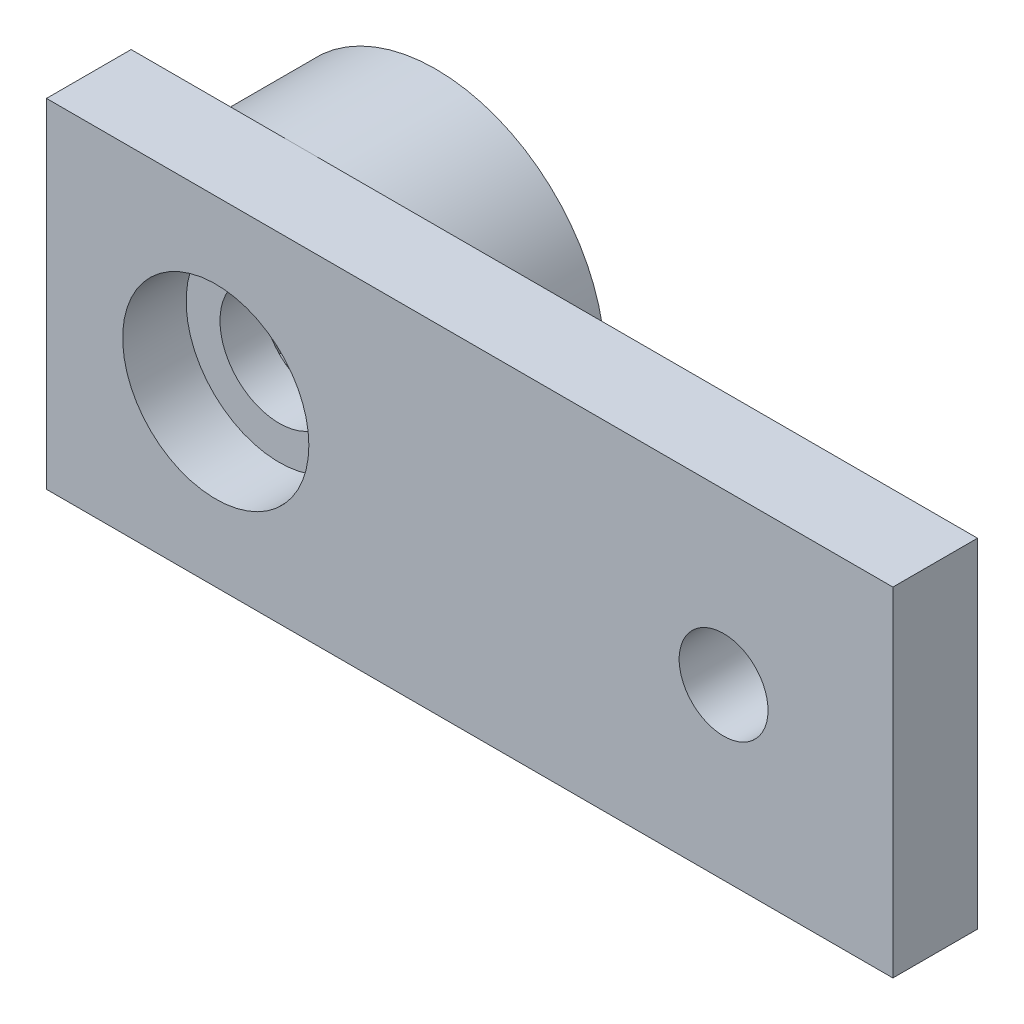
from build123d import *

# Parameters (mm, degrees)
SKETCH1_W                                    = 20
SKETCH1_H                                    = 8
SKETCH1_R                                    = 2.6
SKETCH1_R_2                                  = 1.05
R12_HORN_ENVELOPE_DEPTH                      = 2
REPLACE_CLEARANCE_BORE_WITH_DRIVE_WEB_START  = -0.5
SKETCH2_R                                    = 2.61
REPLACE_CLEARANCE_BORE_WITH_DRIVE_WEB_DEPTH  = 2.5
CUSTOM_SPLINE_HUB_START                      = -3.2
SKETCH3_R                                    = 4
CUSTOM_SPLINE_HUB_DEPTH                      = 3.5
SKETCH4_R                                    = 1.1
M2_RETAINING_SCREW_CLEARANCE_DEPTH           = 5.21
SKETCH5_R                                    = 2.2
SCREW_HEAD_POCKET_D4P4_DEPTH                 = 1.5
FEMALE_SPLINE_FROM_OFFICIAL_21T_STEP_START   = -3.126
FEMALE_SPLINE_FROM_OFFICIAL_21T_STEP_2_O_R   = 2.121
FEMALE_SPLINE_FROM_OFFICIAL_21T_STEP_2_DEPTH = 2.619649147
SKETCH6_R                                    = 2.6
SPLINE_BASE_ENTRY_RELIEF_D5P2_DEPTH          = 0.5
SKETCH7_R                                    = 1.4
SPLINE_CENTRE_TIP_RELIEF_D2P8_DEPTH          = 1.25


with BuildPart() as part:
    # Sketch1 → R12_Horn_Envelope (new body)
    with BuildSketch(Plane.XY):
        with Locations((6, 0)):
            Rectangle(SKETCH1_W, SKETCH1_H)
        Circle(SKETCH1_R, mode=Mode.SUBTRACT)
        with Locations((12, 0)):
            Circle(SKETCH1_R_2, mode=Mode.SUBTRACT)
    extrude(amount=R12_HORN_ENVELOPE_DEPTH)

    # Sketch2 → Replace_Clearance_Bore_With_Drive_Web (add)
    with BuildSketch(Plane.XY.offset(REPLACE_CLEARANCE_BORE_WITH_DRIVE_WEB_START)):
        with Locations(Location((0, 0, 0), (0, 0, 180))):
            Circle(SKETCH2_R)
    extrude(amount=REPLACE_CLEARANCE_BORE_WITH_DRIVE_WEB_DEPTH)

    # Sketch3 → Custom_Spline_Hub (add)
    with BuildSketch(Plane.XY.offset(CUSTOM_SPLINE_HUB_START)):
        with Locations(Location((0, 0, 0), (0, 0, 180))):
            Circle(SKETCH3_R)
    extrude(amount=CUSTOM_SPLINE_HUB_DEPTH)

    # Sketch4 → M2_Retaining_Screw_Clearance (cut)
    with BuildSketch(Plane.XY.offset(2)):
        Circle(SKETCH4_R)
    extrude(amount=-M2_RETAINING_SCREW_CLEARANCE_DEPTH, mode=Mode.SUBTRACT)

    # Sketch5 → Screw_Head_Pocket_D4p4 (cut)
    with BuildSketch(Plane.XY.offset(2)):
        Circle(SKETCH5_R)
    extrude(amount=-SCREW_HEAD_POCKET_D4P4_DEPTH, mode=Mode.SUBTRACT)

    # Female_Spline_From_Official_21T_STEP: read off the stored shape, not the designer's step
    # Female_Spline_From_Official_21T_STEP out → Female_Spline_From_Official_21T_STEP (revolve, cut)
    with BuildSketch(Plane.XZ):
        Polygon((1.111, -0.5), (1.1, -0.506350853), (1.1, -3.2), (2.121, -3.2), (2.121, -0.506350853), (2.127350853, -0.506350853), (2.121, -0.5), align=None)
    revolve(axis=Axis((0, 0, 0), (0, 0, 1)), mode=Mode.SUBTRACT)

    # Female_Spline_From_Official_21T_STEP 2 o → Female_Spline_From_Official_21T_STEP 2 (cut)
    with BuildSketch(Plane.XY.offset(FEMALE_SPLINE_FROM_OFFICIAL_21T_STEP_START)):
        with BuildLine():
            ThreePointArc((-2.507829748, 0.29396421), (-2.517939588, 0.188693486), (-2.523632453, 0.083091756))
            Line((-2.523632453, 0.083091756), (-2.192108096, -0.07656196))
            ThreePointArc((-2.192108096, -0.07656196), (-2.135212771, -0.160012076), (-2.179035028, -0.251009932))
            Line((-2.179035028, -0.251009932), (-2.48306138, -0.458291589))
            ThreePointArc((-2.48306138, -0.458291589), (-2.461692978, -0.561865358), (-2.436006269, -0.664453502))
            Line((-2.436006269, -0.664453502), (-2.07215185, -0.719295731))
            ThreePointArc((-2.07215185, -0.719295731), (-1.993186871, -0.782268202), (-2.008240139, -0.882140115))
            Line((-2.008240139, -0.882140115), (-2.237662113, -1.16982617))
            ThreePointArc((-2.237662113, -1.16982617), (-2.186714145, -1.2625), (-2.131930238, -1.35295915))
            Line((-2.131930238, -1.35295915), (-1.768075819, -1.29811692))
            ThreePointArc((-1.768075819, -1.29811692), (-1.67405757, -1.335016364), (-1.659004301, -1.434888277))
            Line((-1.659004301, -1.434888277), (-1.793436747, -1.777416562))
            ThreePointArc((-1.793436747, -1.777416562), (-1.717436163, -1.850955976), (-1.638422849, -1.92124844))
            Line((-1.638422849, -1.92124844), (-1.306898492, -1.761594724))
            ThreePointArc((-1.306898492, -1.761594724), (-1.206180909, -1.769142464), (-1.162358651, -1.860140319))
            Line((-1.162358651, -1.860140319), (-1.189856655, -2.227075692))
            ThreePointArc((-1.189856655, -2.227075692), (-1.095556441, -2.274946391), (-0.9993344, -2.318826375))
            Line((-0.9993344, -2.318826375), (-0.729597499, -2.068547106))
            ThreePointArc((-0.729597499, -2.068547106), (-0.63112978, -2.046072492), (-0.562432333, -2.120110731))
            Line((-0.562432333, -2.120110731), (-0.480552579, -2.478849374))
            ThreePointArc((-0.480552579, -2.478849374), (-0.376331722, -2.496797836), (-0.271450704, -2.510366411))
            Line((-0.271450704, -2.510366411), (-0.087468566, -2.1917))
            ThreePointArc((-0.087468566, -2.1917), (0, -2.1412), (0.087468566, -2.1917))
            Line((0.087468566, -2.1917), (0.271450704, -2.510366411))
            ThreePointArc((0.271450704, -2.510366411), (0.376331722, -2.496797836), (0.480552579, -2.478849374))
            Line((0.480552579, -2.478849374), (0.562432333, -2.120110731))
            ThreePointArc((0.562432333, -2.120110731), (0.63112978, -2.046072492), (0.729597499, -2.068547106))
            Line((0.729597499, -2.068547106), (0.9993344, -2.318826375))
            ThreePointArc((0.9993344, -2.318826375), (1.095556441, -2.274946391), (1.189856655, -2.227075692))
            Line((1.189856655, -2.227075692), (1.162358651, -1.860140319))
            ThreePointArc((1.162358651, -1.860140319), (1.206180909, -1.769142464), (1.306898492, -1.761594724))
            Line((1.306898492, -1.761594724), (1.638422849, -1.92124844))
            ThreePointArc((1.638422849, -1.92124844), (1.717436163, -1.850955976), (1.793436747, -1.777416562))
            Line((1.793436747, -1.777416562), (1.659004301, -1.434888277))
            ThreePointArc((1.659004301, -1.434888277), (1.67405757, -1.335016364), (1.768075819, -1.29811692))
            Line((1.768075819, -1.29811692), (2.131930238, -1.35295915))
            ThreePointArc((2.131930238, -1.35295915), (2.186714145, -1.2625), (2.237662113, -1.16982617))
            Line((2.237662113, -1.16982617), (2.008240139, -0.882140115))
            ThreePointArc((2.008240139, -0.882140115), (1.993186871, -0.782268202), (2.07215185, -0.719295731))
            Line((2.07215185, -0.719295731), (2.436006269, -0.664453502))
            ThreePointArc((2.436006269, -0.664453502), (2.461692978, -0.561865358), (2.48306138, -0.458291589))
            Line((2.48306138, -0.458291589), (2.179035028, -0.251009932))
            ThreePointArc((2.179035028, -0.251009932), (2.135212771, -0.160012076), (2.192108096, -0.07656196))
            Line((2.192108096, -0.07656196), (2.523632453, 0.083091756))
            ThreePointArc((2.523632453, 0.083091756), (2.517939588, 0.188693486), (2.507829748, 0.29396421))
            Line((2.507829748, 0.29396421), (2.156213092, 0.402423585))
            ThreePointArc((2.156213092, 0.402423585), (2.087515646, 0.476461824), (2.117285918, 0.572974677))
            Line((2.117285918, 0.572974677), (2.387022819, 0.823253946))
            ThreePointArc((2.387022819, 0.823253946), (2.350456215, 0.922486087), (2.309766436, 1.0201))
            Line((2.309766436, 1.0201), (1.94180216, 1.0201))
            ThreePointArc((1.94180216, 1.0201), (1.854333595, 1.0706), (1.854333595, 1.1716))
            Line((1.854333595, 1.1716), (2.038315733, 1.490266411))
            ThreePointArc((2.038315733, 1.490266411), (1.974124493, 1.57431175), (1.906470241, 1.655595428))
            Line((1.906470241, 1.655595428), (1.554853585, 1.547136054))
            ThreePointArc((1.554853585, 1.547136054), (1.456385866, 1.569610668), (1.426615593, 1.666123521))
            Line((1.426615593, 1.666123521), (1.508495348, 2.024862165))
            ThreePointArc((1.508495348, 2.024862165), (1.422383147, 2.086252905), (1.333775798, 2.143983937))
            Line((1.333775798, 2.143983937), (1.029749446, 1.936702279))
            ThreePointArc((1.029749446, 1.936702279), (0.929031862, 1.92915454), (0.872136536, 2.012604656))
            Line((0.872136536, 2.012604656), (0.844638532, 2.379540029))
            ThreePointArc((0.844638532, 2.379540029), (0.744256816, 2.412821335), (0.642569522, 2.441870064))
            Line((0.642569522, 2.441870064), (0.413147549, 2.154184009))
            ThreePointArc((0.413147549, 2.154184009), (0.319129301, 2.117284565), (0.240164321, 2.180257035))
            Line((0.240164321, 2.180257035), (0.105731875, 2.52278532))
            ThreePointArc((0.105731875, 2.52278532), (0, 2.525), (-0.105731875, 2.52278532))
            Line((-0.105731875, 2.52278532), (-0.240164321, 2.180257035))
            ThreePointArc((-0.240164321, 2.180257035), (-0.319129301, 2.117284565), (-0.413147549, 2.154184009))
            Line((-0.413147549, 2.154184009), (-0.642569522, 2.441870064))
            ThreePointArc((-0.642569522, 2.441870064), (-0.744256816, 2.412821335), (-0.844638532, 2.379540029))
            Line((-0.844638532, 2.379540029), (-0.872136536, 2.012604656))
            ThreePointArc((-0.872136536, 2.012604656), (-0.929031862, 1.92915454), (-1.029749446, 1.936702279))
            Line((-1.029749446, 1.936702279), (-1.333775798, 2.143983937))
            ThreePointArc((-1.333775798, 2.143983937), (-1.422383147, 2.086252905), (-1.508495348, 2.024862165))
            Line((-1.508495348, 2.024862165), (-1.426615593, 1.666123521))
            ThreePointArc((-1.426615593, 1.666123521), (-1.456385866, 1.569610668), (-1.554853585, 1.547136054))
            Line((-1.554853585, 1.547136054), (-1.906470241, 1.655595428))
            ThreePointArc((-1.906470241, 1.655595428), (-1.974124493, 1.57431175), (-2.038315733, 1.490266411))
            Line((-2.038315733, 1.490266411), (-1.854333595, 1.1716))
            ThreePointArc((-1.854333595, 1.1716), (-1.854333595, 1.0706), (-1.94180216, 1.0201))
            Line((-1.94180216, 1.0201), (-2.309766436, 1.0201))
            ThreePointArc((-2.309766436, 1.0201), (-2.350456215, 0.922486087), (-2.387022819, 0.823253946))
            Line((-2.387022819, 0.823253946), (-2.117285918, 0.572974677))
            ThreePointArc((-2.117285918, 0.572974677), (-2.087515646, 0.476461824), (-2.156213092, 0.402423585))
            Line((-2.156213092, 0.402423585), (-2.507829748, 0.29396421))
        make_face()
        Circle(FEMALE_SPLINE_FROM_OFFICIAL_21T_STEP_2_O_R, mode=Mode.SUBTRACT)
    extrude(amount=FEMALE_SPLINE_FROM_OFFICIAL_21T_STEP_2_DEPTH, mode=Mode.SUBTRACT)

    # Female_Spline_From_Official_21T_STEP 3 o → Female_Spline_From_Official_21T_STEP 3 (revolve)
    with BuildSketch(Plane.XZ):
        Polygon((2.525000001, -0.506350853), (2.127350853, -0.506350853), (2.525, -0.904), align=None)
    revolve(axis=Axis((0, 0, 0), (0, 0, 1)))

    # Sketch6 → Spline_Base_Entry_Relief_D5p2 (cut)
    with BuildSketch(Plane(origin=(0, 0, -3.2), x_dir=(-1, 0, 0), z_dir=(0, 0, -1))):
        Circle(SKETCH6_R)
    extrude(amount=-SPLINE_BASE_ENTRY_RELIEF_D5P2_DEPTH, mode=Mode.SUBTRACT)

    # Sketch7 → Spline_Centre_Tip_Relief_D2p8 (cut)
    with BuildSketch(Plane.XY.offset(0.5)):
        Circle(SKETCH7_R)
    extrude(amount=-SPLINE_CENTRE_TIP_RELIEF_D2P8_DEPTH, mode=Mode.SUBTRACT)


solid = part.part
